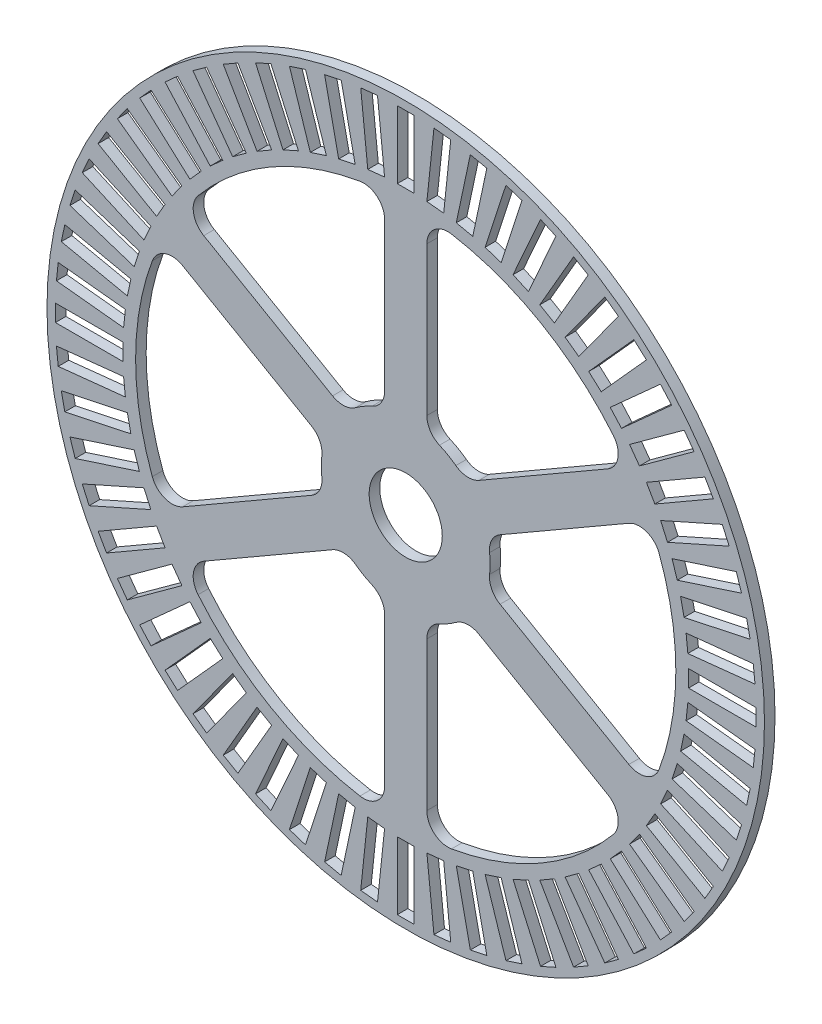
from build123d import *

# Parameters (mm, degrees)
SKETCH1_R           = 53.975
SKETCH1_R_2         = 40.64
BOSS_EXTRUDE1_DEPTH = 1.5875
SKETCH4_W           = 2.54
SKETCH4_H           = 10.16
CUT_EXTRUDE3_DEPTH  = 5.08
CIRPATTERN2_COUNT   = 60
SKETCH8_R           = 5.5
BOSS_EXTRUDE2_DEPTH = 1.5875
FILLET1_R           = 3.175


with BuildPart() as part:
    # Sketch1 → Boss-Extrude1 (new body)
    with BuildSketch(Plane.XY):
        Circle(SKETCH1_R)
        Circle(SKETCH1_R_2, mode=Mode.SUBTRACT)
    extrude(amount=BOSS_EXTRUDE1_DEPTH)

    # Sketch4 → Cut-Extrude3 (cut)
    with BuildSketch(Plane.XY.offset(1.5875)):
        with Locations((0, 47.625)):
            Rectangle(SKETCH4_W, SKETCH4_H)
    cut_extrude3 = extrude(amount=-CUT_EXTRUDE3_DEPTH, mode=Mode.SUBTRACT)

    # CirPattern2: Cut-Extrude3 ×60 about axis
    cirpattern2_axis = Axis((0, 0, 0), (0, 0, -1))
    for i in range(1, CIRPATTERN2_COUNT):
        add(cut_extrude3.rotate(cirpattern2_axis, i * 360 / CIRPATTERN2_COUNT), mode=Mode.SUBTRACT)

    # Sketch8 → Boss-Extrude2 (add)
    with BuildSketch(Plane.XY):
        with BuildLine():
            Line((-3.175, 12.296722124), (-3.175, 40.515786738))
            ThreePointArc((-3.175, 40.515786738), (0, 40.64), (3.175, 40.515786738))
            Line((3.175, 40.515786738), (3.175, 12.296722124))
            ThreePointArc((3.175, 12.296722124), (6.35, 10.998522628), (9.061773743, 8.897991719))
            Line((9.061773743, 8.897991719), (33.500200569, 23.007524026))
            ThreePointArc((33.500200569, 23.007524026), (35.19527241, 20.32), (36.675200569, 17.508262712))
            Line((36.675200569, 17.508262712), (12.236773743, 3.398730405))
            ThreePointArc((12.236773743, 3.398730405), (12.7, 0), (12.236773743, -3.398730405))
            Line((12.236773743, -3.398730405), (36.675200569, -17.508262712))
            ThreePointArc((36.675200569, -17.508262712), (35.19527241, -20.32), (33.500200569, -23.007524026))
            Line((33.500200569, -23.007524026), (9.061773743, -8.897991719))
            ThreePointArc((9.061773743, -8.897991719), (6.35, -10.998522628), (3.175, -12.296722124))
            Line((3.175, -12.296722124), (3.175, -40.515786738))
            ThreePointArc((3.175, -40.515786738), (0, -40.64), (-3.175, -40.515786738))
            Line((-3.175, -40.515786738), (-3.175, -12.296722124))
            ThreePointArc((-3.175, -12.296722124), (-6.35, -10.998522628), (-9.061773743, -8.897991719))
            Line((-9.061773743, -8.897991719), (-33.500200569, -23.007524026))
            ThreePointArc((-33.500200569, -23.007524026), (-35.19527241, -20.32), (-36.675200569, -17.508262712))
            Line((-36.675200569, -17.508262712), (-12.236773743, -3.398730405))
            ThreePointArc((-12.236773743, -3.398730405), (-12.7, 0), (-12.236773743, 3.398730405))
            Line((-12.236773743, 3.398730405), (-36.675200569, 17.508262712))
            ThreePointArc((-36.675200569, 17.508262712), (-35.19527241, 20.32), (-33.500200569, 23.007524026))
            Line((-33.500200569, 23.007524026), (-9.061773743, 8.897991719))
            ThreePointArc((-9.061773743, 8.897991719), (-6.35, 10.998522628), (-3.175, 12.296722124))
        make_face()
        Circle(SKETCH8_R, mode=Mode.SUBTRACT)
    extrude(amount=BOSS_EXTRUDE2_DEPTH)

    # Fillet1
    fillet1_edges = [part.edges().sort_by_distance(p)[0] for p in [
        (12.236773743, -3.398730405, 0.79375),
        (12.236773743, 3.398730405, 0.79375),
        (9.061773743, -8.897991719, 0.79375),
        (3.175, -12.296722124, 0.79375),
        (-3.175, -12.296722124, 0.79375),
        (-9.061773743, -8.897991719, 0.79375),
        (-12.236773743, 3.398730405, 0.79375),
        (-12.236773743, -3.398730405, 0.79375),
        (-3.175, 12.296722124, 0.79375),
        (-9.061773743, 8.897991719, 0.79375),
        (3.175, 12.296722124, 0.79375),
        (9.061773743, 8.897991719, 0.79375),
        (3.175, 40.515786738, 0.79375),
        (33.500200569, 23.007524026, 0.79375),
        (36.675200569, 17.508262712, 0.79375),
        (36.675200569, -17.508262712, 0.79375),
        (33.500200569, -23.007524026, 0.79375),
        (3.175, -40.515786738, 0.79375),
        (-3.175, -40.515786738, 0.79375),
        (-33.500200569, -23.007524026, 0.79375),
        (-36.675200569, -17.508262712, 0.79375),
        (-36.675200569, 17.508262712, 0.79375),
        (-33.500200569, 23.007524026, 0.79375),
        (-3.175, 40.515786738, 0.79375),
    ]]
    fillet(fillet1_edges, radius=FILLET1_R)


solid = part.part
